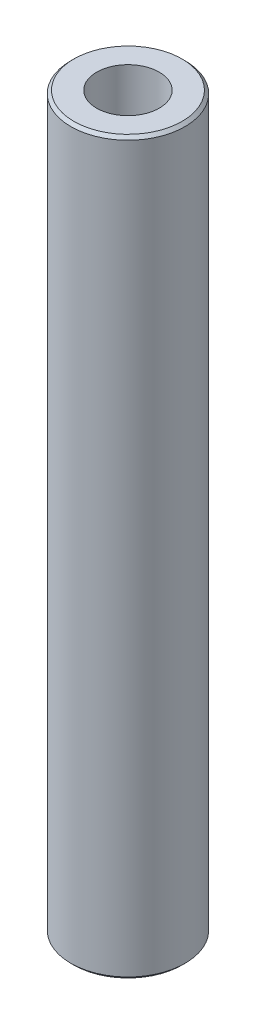
from build123d import *

# Parameters (mm, degrees)
SKETCH1_R           = 7.5
BOSS_EXTRUDE1_DEPTH = 95.949593354
SKETCH2_R           = 4.10759111
CUT_EXTRUDE1_DEPTH  = 97.534058574
CHAMFER1_SIZE       = 0.395426419


with BuildPart() as part:
    # Sketch1 → Boss-Extrude1 (new body)
    with BuildSketch(Plane(origin=(0, 0, 0), x_dir=(1, 0, 0), z_dir=(0, 1, 0))):
        Circle(SKETCH1_R)
    extrude(amount=BOSS_EXTRUDE1_DEPTH)

    # Sketch2 → Cut-Extrude1 (cut, through all)
    with BuildSketch(Plane(origin=(0, 0, 0), x_dir=(1, 0, 0), z_dir=(0, 1, 0))):
        Circle(SKETCH2_R)
    extrude(amount=CUT_EXTRUDE1_DEPTH, mode=Mode.SUBTRACT)

    # Chamfer1
    chamfer1_edges = [part.edges().sort_by_distance(p)[0] for p in [
        (-7.5, 95.949593354, 0),
        (-7.5, 0, 0),
    ]]
    chamfer(chamfer1_edges, length=CHAMFER1_SIZE)


solid = part.part
